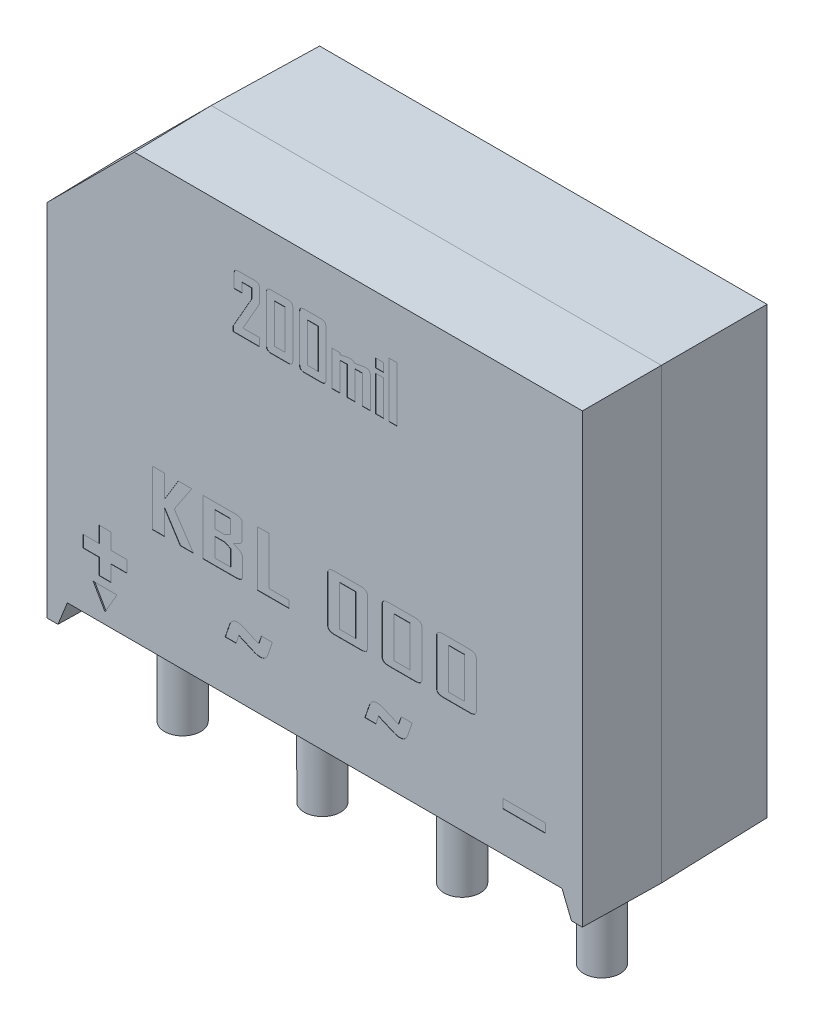
from build123d import *
from OCP.BRepFilletAPI import BRepFilletAPI_MakeChamfer

# Parameters (mm, degrees)
BODY_MAIN_DEPTH            = 2.82
BODY_MAIN_DEPTH_BACK       = 3.91
SKETCH1_W                  = 19.56
SKETCH1_H                  = 16.3
CUT_EXTRUDE2_DEPTH         = 25.773834988
BODY_CHAMFER_SIZE          = 3.2
BODY_CHAMFER1_SIZE         = 2.82
BODY_CHAMFER1_SIZE2        = 0.049223283
BODY_CHAMFER2_SIZE         = 0.068249304
BODY_CHAMFER2_SIZE_2       = 3.91
SKETCH10_R                 = 0.66
PIN_STRAIGHT_PATTERN_COUNT = 4
PIN_STRAIGHT_PATTERN_PITCH = 5.08
SKETCH5_W                  = 0.578313253
SKETCH5_H                  = 1.469879518
SKETCH5_W_2                = 0.385542169
SKETCH5_H_2                = 1.421686747
SKETCH5_W_3                = 0.294427711
SKETCH5_H_3                = 0.313253012
SKETCH5_W_4                = 0.289156626
SKETCH5_H_4                = 1.277108434
SKETCH5_H_5                = 2
SKETCH5_W_5                = 1.554216868
SKETCH5_H_6                = 0.325301205
TEXT_2_DEPTH               = 0.01
PIN1_MARK_DEPTH            = 0.04


with BuildPart() as part:
    # Sketch1 → BODY_MAIN (new, two sides: drawn at the far end of the back side and taken through both)
    with BuildSketch(Plane.XY.offset(-BODY_MAIN_DEPTH_BACK)):
        with Locations((7.62, 8.15)):
            Rectangle(SKETCH1_W, SKETCH1_H)
    extrude(amount=BODY_MAIN_DEPTH + BODY_MAIN_DEPTH_BACK)

    # Sketch18 → Cut-Extrude2 (cut, through all)
    with BuildSketch(Plane.XY.offset(2.82)):
        Polygon((16.576779019, 0.8), (-1.336779019, 0.8), (-1.66, 0), (-1.66, -1), (16.9, -1), (16.9, 0), align=None)
    extrude(amount=-CUT_EXTRUDE2_DEPTH, mode=Mode.SUBTRACT)

    # BODY_Chamfer
    body_chamfer_edges = [part.edges().sort_by_distance(p)[0] for p in [
        (-2.16, 16.3, -0.545),
    ]]
    chamfer(body_chamfer_edges, length=BODY_CHAMFER_SIZE)

    # BODY_Chamfer1: one chamfer whose edges measure the first distance from different faces: ONE call of the kernel's chamfer builder (chamfer() names one face for all edges)
    body_chamfer1_edges_1 = [part.edges().sort_by_distance(p)[0] for p in [
        (17.4, 8.15, 2.82),
    ]]
    body_chamfer1_side_1 = [part.faces().sort_by_distance(p)[0] for p in [
        (17.4, 8.15, -0.545),
    ]]
    body_chamfer1_edges_2 = [part.edges().sort_by_distance(p)[0] for p in [
        (9.22, 16.3, 2.82),
    ]]
    body_chamfer1_side_2 = [part.faces().sort_by_distance(p)[0] for p in [
        (9.22, 16.3, -0.545),
    ]]
    body_chamfer1_edges_3 = [part.edges().sort_by_distance(p)[0] for p in [
        (16.73838951, 0.4, 2.82),
    ]]
    body_chamfer1_side_3 = [part.faces().sort_by_distance(p)[0] for p in [
        (16.73838951, 0.4, -0.545),
    ]]
    body_chamfer1_edges_4 = [part.edges().sort_by_distance(p)[0] for p in [
        (7.62, 0.8, 2.82),
    ]]
    body_chamfer1_side_4 = [part.faces().sort_by_distance(p)[0] for p in [
        (7.62, 0.8, -0.545),
    ]]
    body_chamfer1_edges_5 = [part.edges().sort_by_distance(p)[0] for p in [
        (-1.49838951, 0.4, 2.82),
    ]]
    body_chamfer1_side_5 = [part.faces().sort_by_distance(p)[0] for p in [
        (-1.49838951, 0.4, -0.545),
    ]]
    body_chamfer1_edges_6 = [part.edges().sort_by_distance(p)[0] for p in [
        (-2.16, 6.55, 2.82),
    ]]
    body_chamfer1_side_6 = [part.faces().sort_by_distance(p)[0] for p in [
        (-2.16, 6.55, -0.545),
    ]]
    body_chamfer1_edges_7 = [part.edges().sort_by_distance(p)[0] for p in [
        (-0.56, 14.7, 2.82),
    ]]
    body_chamfer1_side_7 = [part.faces().sort_by_distance(p)[0] for p in [
        (-0.56, 14.7, -0.545),
    ]]
    body_chamfer1 = BRepFilletAPI_MakeChamfer(part.part.solid().wrapped)
    for e in body_chamfer1_edges_1:
        body_chamfer1.Add(BODY_CHAMFER1_SIZE, BODY_CHAMFER1_SIZE2, e.wrapped, body_chamfer1_side_1[0].wrapped)  # the first distance lies on this face
    for e in body_chamfer1_edges_2:
        body_chamfer1.Add(BODY_CHAMFER1_SIZE, BODY_CHAMFER1_SIZE2, e.wrapped, body_chamfer1_side_2[0].wrapped)  # the first distance lies on this face
    for e in body_chamfer1_edges_3:
        body_chamfer1.Add(BODY_CHAMFER1_SIZE, BODY_CHAMFER1_SIZE2, e.wrapped, body_chamfer1_side_3[0].wrapped)  # the first distance lies on this face
    for e in body_chamfer1_edges_4:
        body_chamfer1.Add(BODY_CHAMFER1_SIZE, BODY_CHAMFER1_SIZE2, e.wrapped, body_chamfer1_side_4[0].wrapped)  # the first distance lies on this face
    for e in body_chamfer1_edges_5:
        body_chamfer1.Add(BODY_CHAMFER1_SIZE, BODY_CHAMFER1_SIZE2, e.wrapped, body_chamfer1_side_5[0].wrapped)  # the first distance lies on this face
    for e in body_chamfer1_edges_6:
        body_chamfer1.Add(BODY_CHAMFER1_SIZE, BODY_CHAMFER1_SIZE2, e.wrapped, body_chamfer1_side_6[0].wrapped)  # the first distance lies on this face
    for e in body_chamfer1_edges_7:
        body_chamfer1.Add(BODY_CHAMFER1_SIZE, BODY_CHAMFER1_SIZE2, e.wrapped, body_chamfer1_side_7[0].wrapped)  # the first distance lies on this face
    add(Compound.cast(body_chamfer1.Shape()), mode=Mode.REPLACE)

    # BODY_Chamfer2
    # the kernel refuses this chamfer: 3.91, 0.068249304 mm, written as the material it takes off along each edge
    with BuildSketch(Plane(origin=(27.565942739, 0, -3.91), x_dir=(0, 1, 0), z_dir=(-1, 0, 0)), Plane(origin=(8.505942739, 0, -3.91), x_dir=(0, 1, 0), z_dir=(-1, 0, 0))) as body_chamfer2_piece_1:
        Polygon((BODY_CHAMFER2_SIZE * 0.999999998085, 0), (0, -BODY_CHAMFER2_SIZE_2), (0, 0), align=None)
    extrude(amount=20.831885478, mode=Mode.SUBTRACT)
    with BuildSketch(Plane(origin=(17.4, 26.465942739, -3.91), x_dir=(-1, 0, 0), z_dir=(0, -1, 0))) as body_chamfer2_piece_2:
        Polygon((BODY_CHAMFER2_SIZE * 0.999999998085, 0), (0, -BODY_CHAMFER2_SIZE_2), (0, 0), align=None)
    extrude(amount=36.631885478, mode=Mode.SUBTRACT)
    with BuildSketch(Plane(origin=(-9.125942739, 16.3, -3.91), x_dir=(0, 0, 1), z_dir=(1, 0, 0))) as body_chamfer2_piece_3:
        Polygon((BODY_CHAMFER2_SIZE_2, 0), (0, BODY_CHAMFER2_SIZE * 0.999999998085), (0, 0), align=None)
    extrude(amount=36.691885478, mode=Mode.SUBTRACT)
    with BuildSketch(Plane(origin=(-2.16, -10.165942739, -3.91), x_dir=(1, 0, 0), z_dir=(0, 1, 0))) as body_chamfer2_piece_4:
        Polygon((BODY_CHAMFER2_SIZE * 0.999999998085, 0), (0, -BODY_CHAMFER2_SIZE_2), (0, 0), align=None)
    extrude(amount=33.431885478, mode=Mode.SUBTRACT)
    with BuildSketch(Plane(origin=(-5.468229178, -9.425697974, -3.91), x_dir=(-0.9271838545667888, 0.37460659341590863, 0), z_dir=(0.3746065934159087, 0.9271838545667888, 0))) as body_chamfer2_piece_5_section:
        Polygon((BODY_CHAMFER2_SIZE * 0.999999998085, 0), (0, BODY_CHAMFER2_SIZE_2), (0, 0), align=None)
    body_chamfer2_piece_5 = extrude(amount=21.194713272, mode=Mode.PRIVATE)
    body_chamfer2_piece_5 = split(body_chamfer2_piece_5, bisect_by=Plane(origin=(-5.468229178, 0.865113907, -3.73037321), z_dir=(0, -0.9998476951563913, -0.01745240643728347)), keep=Keep.TOP, mode=Mode.PRIVATE)
    add(body_chamfer2_piece_5, mode=Mode.SUBTRACT)
    with BuildSketch(Plane(origin=(-11.502721758, 0.8, -3.91), x_dir=(0, 1, 0), z_dir=(1, 0, 0))) as body_chamfer2_piece_6_section:
        Polygon((BODY_CHAMFER2_SIZE * 0.999999998085, 0), (0, BODY_CHAMFER2_SIZE_2), (0, 0), align=None)
    body_chamfer2_piece_6 = extrude(amount=38.245443517, mode=Mode.PRIVATE)
    body_chamfer2_piece_6 = split(body_chamfer2_piece_6, bisect_by=Plane(origin=(12.692287806, 10.575418398, -3.454507316), z_dir=(-0.9270426399748221, -0.3745495390172843, -0.01745240643728383)), keep=Keep.TOP, mode=Mode.PRIVATE)
    body_chamfer2_piece_6 = split(body_chamfer2_piece_6, bisect_by=Plane(origin=(-2.829289047, -2.704294284, -4.073285125), z_dir=(0.9270426399748225, -0.37454953901728366, -0.01745240643728332)), keep=Keep.TOP, mode=Mode.PRIVATE)
    add(body_chamfer2_piece_6, mode=Mode.SUBTRACT)
    with BuildSketch(Plane(origin=(12.768549841, 10.225697974, -3.91), x_dir=(0.9271838545667884, 0.37460659341590935, 0), z_dir=(0.3746065934159094, -0.9271838545667885, 0))) as body_chamfer2_piece_7_section:
        Polygon((BODY_CHAMFER2_SIZE * 0.999999998085, 0), (0, BODY_CHAMFER2_SIZE_2), (0, 0), align=None)
    body_chamfer2_piece_7 = extrude(amount=21.194713272, mode=Mode.PRIVATE)
    body_chamfer2_piece_7 = split(body_chamfer2_piece_7, bisect_by=Plane(origin=(12.768549841, 0.871099456, -4.073285125), z_dir=(0, -0.9998476951563913, -0.01745240643728347)), keep=Keep.TOP, mode=Mode.PRIVATE)
    add(body_chamfer2_piece_7, mode=Mode.SUBTRACT)
    with BuildSketch(Plane(origin=(8.228407048, 23.488407048, -3.91), x_dir=(0, 0, 1), z_dir=(-0.7071067811865477, -0.7071067811865475, 0))) as body_chamfer2_piece_8:
        Polygon((BODY_CHAMFER2_SIZE_2, 0), (0, -BODY_CHAMFER2_SIZE * 0.999999998085), (0, 0), align=None)
    extrude(amount=24.857368878, mode=Mode.SUBTRACT)

    # PIN_straight: sweep along a path in Sketch12
    with BuildLine(Plane(origin=(0, 0, 0), x_dir=(0, 0, -1), z_dir=(1, 0, 0))) as pin_straight_path:
        Line((0, -3.6), (0, 0))
        Line((0, 0), (0, 1.3))
    # Sketch10 → PIN_straight (sweep)
    with BuildSketch(Plane(origin=(0, 0, 0), x_dir=(1, 0, 0), z_dir=(0, 1, 0))):
        Circle(SKETCH10_R)
    pin_straight = sweep(path=pin_straight_path.line)

    # PIN_straight_Pattern: PIN_straight ×4
    with Locations(*[(i * PIN_STRAIGHT_PATTERN_PITCH, 0, 0) for i in range(1, PIN_STRAIGHT_PATTERN_COUNT)]):
        add(pin_straight)

    # Sketch5 → text 2 (cut)
    # profile 1 of 17: a face of its own
    with BuildSketch(Plane.XY.offset(2.82)):
        Polygon((3.215180723, 4.699611642), (2.733253012, 4.699611642), (2.154939759, 5.604355617), (2.154939759, 4.699611642), (1.721204819, 4.699611642), (1.721204819, 6.699611642), (2.154939759, 6.699611642), (2.154939759, 5.864897786), (2.660963855, 6.699611642), (3.142891566, 6.699611642), (3.142891566, 6.685680919), (2.516385542, 5.747804413), align=None)
    # profile 2 of 17: a face of its own
    with BuildSketch(Plane.XY.offset(2.82)):
        with BuildLine():
            add(Edge.make_bspline(
                [(5.000722892, 4.857367666), (4.99970317, 4.845316128), (4.997747343, 4.822201283), (4.984927836, 4.790265324), (4.965851509, 4.762598067), (4.938650178, 4.740604955), (4.905285777, 4.722631937), (4.864712097, 4.710356641), (4.817560014, 4.702064158), (4.783770402, 4.700463645), (4.765783133, 4.699611642)],
                knots=[0, 0, 0, 0, 0.912786698, 1.750724646, 2.577393401, 3.435475294, 4.376805661, 5.436517424, 6.635377905, 8, 8, 8, 8], degree=3))
            Line((4.765783133, 4.699611642), (3.554939759, 4.699611642))
            Line((3.554939759, 4.699611642), (3.554939759, 6.699611642))
            Line((3.554939759, 6.699611642), (4.758253012, 6.699611642))
            add(Edge.make_bspline(
                [(4.758253012, 6.699611642), (4.775615053, 6.698759619), (4.808286003, 6.697156329), (4.853924127, 6.688820642), (4.893303991, 6.67662379), (4.925576224, 6.658498119), (4.952005817, 6.636597521), (4.970231662, 6.608806016), (4.982615225, 6.576958622), (4.984616956, 6.553900873), (4.985662651, 6.541855617)],
                knots=[0, 0, 0, 0, 1.345028062, 2.531001147, 3.585414672, 4.521117009, 5.382572416, 6.215698828, 7.067889818, 8, 8, 8, 8], degree=3))
            Line((4.985662651, 6.541855617), (4.985662651, 6.018512244))
            add(Edge.make_bspline(
                [(4.985662651, 6.018512244), (4.985343869, 6.009340281), (4.98472473, 5.991526472), (4.980760616, 5.965472491), (4.972843075, 5.941422688), (4.96332544, 5.918322395), (4.949791596, 5.897321399), (4.934020337, 5.877495462), (4.914903414, 5.859613056), (4.900451678, 5.849417362), (4.893042169, 5.844189955)],
                knots=[0, 0, 0, 0, 1.067017439, 2.07236394, 3.050976564, 4.005345974, 4.969154372, 5.944714955, 6.946240447, 8, 8, 8, 8], degree=3))
            add(Edge.make_bspline(
                [(4.893042169, 5.844189955), (4.890919904, 5.842914723), (4.88480326, 5.839239338), (4.872163917, 5.832973076), (4.853263213, 5.823977147), (4.828128446, 5.811995312), (4.796799981, 5.796839081), (4.759302367, 5.77883387), (4.715536077, 5.758052357), (4.684218825, 5.74351177), (4.66751506, 5.73575622)],
                knots=[0, 0, 0, 0, 0.237364915, 0.684116738, 1.351591564, 2.245176257, 3.354019085, 4.688968736, 6.233986598, 8, 8, 8, 8], degree=3))
            add(Edge.make_bspline(
                [(4.66751506, 5.73575622), (4.684811439, 5.727550336), (4.717123035, 5.712220814), (4.762752969, 5.691440309), (4.801232451, 5.672101031), (4.834063539, 5.65734676), (4.859614494, 5.64391981), (4.87946714, 5.634933919), (4.892394205, 5.627882942), (4.898820358, 5.624067984), (4.900948795, 5.622804413)],
                knots=[0, 0, 0, 0, 1.771403171, 3.309181819, 4.638758348, 5.755620115, 6.63848141, 7.308497844, 7.770964207, 8, 8, 8, 8], degree=3))
            add(Edge.make_bspline(
                [(4.900948795, 5.622804413), (4.908882868, 5.617223639), (4.924450456, 5.606273501), (4.944655839, 5.58699005), (4.961996641, 5.566289844), (4.976255893, 5.544210183), (4.987551507, 5.520472911), (4.994730241, 5.494978362), (5.000046765, 5.468153317), (5.00049455, 5.449639707), (5.000722892, 5.440198991)],
                knots=[0, 0, 0, 0, 1.069259946, 2.098014239, 3.071585164, 4.043578497, 4.991592967, 5.960027321, 6.959748817, 8, 8, 8, 8], degree=3))
            Line((5.000722892, 5.440198991), (5.000722892, 4.857367666))
        make_face()
        Polygon((4.551927711, 5.961283328), (4.551927711, 6.458647786), (3.988674699, 6.458647786), (3.988674699, 5.856238148), (4.338072289, 5.856238148), align=None, mode=Mode.SUBTRACT)
        Polygon((4.566987952, 4.940575497), (4.566987952, 5.51700622), (4.34560241, 5.615274292), (3.988674699, 5.615274292), (3.988674699, 4.940575497), align=None, mode=Mode.SUBTRACT)
    # profile 3 of 17: a face of its own
    with BuildSketch(Plane.XY.offset(2.82)):
        Polygon((6.689879518, 4.699611642), (5.533253012, 4.699611642), (5.533253012, 6.699611642), (5.966987952, 6.699611642), (5.966987952, 4.964671883), (6.689879518, 4.964671883), align=None)
    # profile 4 of 17: a face of its own
    with BuildSketch(Plane.XY.offset(2.82)):
        with BuildLine():
            add(Edge.make_bspline(
                [(9.538072289, 4.857367666), (9.537052567, 4.845316128), (9.535096741, 4.822201283), (9.522277234, 4.790265324), (9.503200907, 4.762598067), (9.475999575, 4.740604955), (9.442635174, 4.722631937), (9.402061494, 4.710356641), (9.354909412, 4.702064158), (9.321119799, 4.700463645), (9.30313253, 4.699611642)],
                knots=[0, 0, 0, 0, 0.912786698, 1.750724646, 2.577393401, 3.435475294, 4.376805661, 5.436517424, 6.635377905, 8, 8, 8, 8], degree=3))
            Line((9.30313253, 4.699611642), (8.327228916, 4.699611642))
            add(Edge.make_bspline(
                [(8.327228916, 4.699611642), (8.309241646, 4.700463645), (8.275452034, 4.702064158), (8.228299952, 4.710356641), (8.187726271, 4.722631937), (8.154361871, 4.740604955), (8.127160539, 4.762598067), (8.108084212, 4.790265324), (8.095264705, 4.822201283), (8.093308879, 4.845316128), (8.092289157, 4.857367666)],
                knots=[0, 0, 0, 0, 1.364622095, 2.563482576, 3.623194339, 4.564524706, 5.422606599, 6.249275354, 7.087213302, 8, 8, 8, 8], degree=3))
            Line((8.092289157, 4.857367666), (8.092289157, 6.541855617))
            add(Edge.make_bspline(
                [(8.092289157, 6.541855617), (8.093274744, 6.553919823), (8.095168889, 6.577105325), (8.108514194, 6.608977836), (8.127951634, 6.63677701), (8.155938448, 6.658604559), (8.190010146, 6.676584747), (8.231560437, 6.688957277), (8.279860835, 6.697107164), (8.314516026, 6.698744287), (8.332876506, 6.699611642)],
                knots=[0, 0, 0, 0, 0.898785286, 1.727323638, 2.546744885, 3.406099796, 4.349527069, 5.410850413, 6.628256588, 8, 8, 8, 8], degree=3))
            Line((8.332876506, 6.699611642), (9.30313253, 6.699611642))
            add(Edge.make_bspline(
                [(9.30313253, 6.699611642), (9.321119799, 6.698759638), (9.354909412, 6.697159125), (9.402061494, 6.688866642), (9.442635174, 6.676591346), (9.475999575, 6.658618328), (9.503200907, 6.636625216), (9.522277234, 6.608957959), (9.535096741, 6.577022), (9.537052567, 6.553907155), (9.538072289, 6.541855617)],
                knots=[0, 0, 0, 0, 1.364622095, 2.563482576, 3.623194339, 4.564524706, 5.422606599, 6.249275354, 7.087213302, 8, 8, 8, 8], degree=3))
            Line((9.538072289, 6.541855617), (9.538072289, 4.857367666))
        make_face()
        with Locations((8.815180722, 5.699611642)):
            Rectangle(SKETCH5_W, SKETCH5_H, mode=Mode.SUBTRACT)
    # profile 5 of 17: a face of its own
    with BuildSketch(Plane.XY.offset(2.82)):
        with BuildLine():
            add(Edge.make_bspline(
                [(11.516385542, 4.857367666), (11.51536582, 4.845316128), (11.513409994, 4.822201283), (11.500590487, 4.790265324), (11.48151416, 4.762598067), (11.454312828, 4.740604955), (11.420948427, 4.722631937), (11.380374747, 4.710356641), (11.333222665, 4.702064158), (11.299433052, 4.700463645), (11.281445783, 4.699611642)],
                knots=[0, 0, 0, 0, 0.912786698, 1.750724646, 2.577393401, 3.435475294, 4.376805661, 5.436517424, 6.635377905, 8, 8, 8, 8], degree=3))
            Line((11.281445783, 4.699611642), (10.305542169, 4.699611642))
            add(Edge.make_bspline(
                [(10.305542169, 4.699611642), (10.287554899, 4.700463645), (10.253765287, 4.702064158), (10.206613205, 4.710356641), (10.166039524, 4.722631937), (10.132675124, 4.740604955), (10.105473792, 4.762598067), (10.086397465, 4.790265324), (10.073577958, 4.822201283), (10.071622132, 4.845316128), (10.07060241, 4.857367666)],
                knots=[0, 0, 0, 0, 1.364622095, 2.563482576, 3.623194339, 4.564524706, 5.422606599, 6.249275354, 7.087213302, 8, 8, 8, 8], degree=3))
            Line((10.07060241, 4.857367666), (10.07060241, 6.541855617))
            add(Edge.make_bspline(
                [(10.07060241, 6.541855617), (10.071587997, 6.553919823), (10.073482142, 6.577105325), (10.086827447, 6.608977836), (10.106264887, 6.63677701), (10.134251701, 6.658604559), (10.168323399, 6.676584747), (10.20987369, 6.688957277), (10.258174088, 6.697107164), (10.292829279, 6.698744287), (10.311189759, 6.699611642)],
                knots=[0, 0, 0, 0, 0.898785286, 1.727323638, 2.546744885, 3.406099796, 4.349527069, 5.410850413, 6.628256588, 8, 8, 8, 8], degree=3))
            Line((10.311189759, 6.699611642), (11.281445783, 6.699611642))
            add(Edge.make_bspline(
                [(11.281445783, 6.699611642), (11.299433052, 6.698759638), (11.333222665, 6.697159125), (11.380374747, 6.688866642), (11.420948427, 6.676591346), (11.454312828, 6.658618328), (11.48151416, 6.636625216), (11.500590487, 6.608957959), (11.513409994, 6.577022), (11.51536582, 6.553907155), (11.516385542, 6.541855617)],
                knots=[0, 0, 0, 0, 1.364622095, 2.563482576, 3.623194339, 4.564524706, 5.422606599, 6.249275354, 7.087213302, 8, 8, 8, 8], degree=3))
            Line((11.516385542, 6.541855617), (11.516385542, 4.857367666))
        make_face()
        with Locations((10.793493976, 5.699611642)):
            Rectangle(SKETCH5_W, SKETCH5_H, mode=Mode.SUBTRACT)
    # profile 6 of 17: a face of its own
    with BuildSketch(Plane.XY.offset(2.82)):
        with BuildLine():
            add(Edge.make_bspline(
                [(13.494698795, 4.857367666), (13.493679073, 4.845316128), (13.491723247, 4.822201283), (13.47890374, 4.790265324), (13.459827413, 4.762598067), (13.432626081, 4.740604955), (13.39926168, 4.722631937), (13.358688, 4.710356641), (13.311535918, 4.702064158), (13.277746305, 4.700463645), (13.259759036, 4.699611642)],
                knots=[0, 0, 0, 0, 0.912786698, 1.750724646, 2.577393401, 3.435475294, 4.376805661, 5.436517424, 6.635377905, 8, 8, 8, 8], degree=3))
            Line((13.259759036, 4.699611642), (12.283855422, 4.699611642))
            add(Edge.make_bspline(
                [(12.283855422, 4.699611642), (12.265868152, 4.700463645), (12.23207854, 4.702064158), (12.184926458, 4.710356641), (12.144352777, 4.722631937), (12.110988377, 4.740604955), (12.083787045, 4.762598067), (12.064710718, 4.790265324), (12.051891211, 4.822201283), (12.049935385, 4.845316128), (12.048915663, 4.857367666)],
                knots=[0, 0, 0, 0, 1.364622095, 2.563482576, 3.623194339, 4.564524706, 5.422606599, 6.249275354, 7.087213302, 8, 8, 8, 8], degree=3))
            Line((12.048915663, 4.857367666), (12.048915663, 6.541855617))
            add(Edge.make_bspline(
                [(12.048915663, 6.541855617), (12.04990125, 6.553919823), (12.051795395, 6.577105325), (12.0651407, 6.608977836), (12.08457814, 6.63677701), (12.112564954, 6.658604559), (12.146636652, 6.676584747), (12.188186943, 6.688957277), (12.236487341, 6.697107164), (12.271142532, 6.698744287), (12.289503012, 6.699611642)],
                knots=[0, 0, 0, 0, 0.898785286, 1.727323638, 2.546744885, 3.406099796, 4.349527069, 5.410850413, 6.628256588, 8, 8, 8, 8], degree=3))
            Line((12.289503012, 6.699611642), (13.259759036, 6.699611642))
            add(Edge.make_bspline(
                [(13.259759036, 6.699611642), (13.277746305, 6.698759638), (13.311535918, 6.697159125), (13.358688, 6.688866642), (13.39926168, 6.676591346), (13.432626081, 6.658618328), (13.459827413, 6.636625216), (13.47890374, 6.608957959), (13.491723247, 6.577022), (13.493679073, 6.553907155), (13.494698795, 6.541855617)],
                knots=[0, 0, 0, 0, 1.364622095, 2.563482576, 3.623194339, 4.564524706, 5.422606599, 6.249275354, 7.087213302, 8, 8, 8, 8], degree=3))
            Line((13.494698795, 6.541855617), (13.494698795, 4.857367666))
        make_face()
        with Locations((12.771807229, 5.699611642)):
            Rectangle(SKETCH5_W, SKETCH5_H, mode=Mode.SUBTRACT)
    # profile 7 of 17: a face of its own
    with BuildSketch(Plane.XY.offset(2.82)):
        with BuildLine():
            add(Edge.make_bspline(
                [(5.62, 13.852195587), (5.61912135, 13.836061591), (5.617293817, 13.802503978), (5.604221632, 13.751330297), (5.584394731, 13.697484647), (5.565494647, 13.662349415), (5.55561747, 13.643987756)],
                knots=[0, 0, 0, 0, 0.878890772, 1.828032848, 2.864930751, 4, 4, 4, 4], degree=3))
            Line((5.55561747, 13.643987756), (5.011942771, 12.689544985))
            Line((5.011942771, 12.689544985), (5.62, 12.689544985))
            Line((5.62, 12.689544985), (5.62, 12.400388358))
            Line((5.62, 12.400388358), (4.656144578, 12.400388358))
            Line((4.656144578, 12.400388358), (4.656144578, 12.58111125))
            Line((4.656144578, 12.58111125), (5.330843373, 13.765599202))
            Line((5.330843373, 13.765599202), (5.330843373, 14.111231732))
            Line((5.330843373, 14.111231732), (4.96939759, 14.111231732))
            Line((4.96939759, 14.111231732), (4.96939759, 13.773882334))
            Line((4.96939759, 13.773882334), (4.680240964, 13.773882334))
            Line((4.680240964, 13.773882334), (4.680240964, 14.242632334))
            add(Edge.make_bspline(
                [(4.680240964, 14.242632334), (4.681091559, 14.254617149), (4.682698142, 14.277253747), (4.691222482, 14.308811933), (4.703730333, 14.336257155), (4.722170371, 14.358458951), (4.744372167, 14.37689899), (4.771817389, 14.38940684), (4.803375576, 14.397931181), (4.826012173, 14.399537763), (4.837996988, 14.400388358)],
                knots=[0, 0, 0, 0, 1.144701434, 2.162081395, 3.105417678, 4, 4.894582322, 5.837918605, 6.855298566, 8, 8, 8, 8], degree=3))
            Line((4.837996988, 14.400388358), (5.462243976, 14.400388358))
            add(Edge.make_bspline(
                [(5.462243976, 14.400388358), (5.474228791, 14.399537763), (5.496865388, 14.397931181), (5.528423574, 14.38940684), (5.555868796, 14.37689899), (5.578070592, 14.358458951), (5.596510631, 14.336257155), (5.609018482, 14.308811933), (5.617542822, 14.277253747), (5.619149404, 14.254617149), (5.62, 14.242632334)],
                knots=[0, 0, 0, 0, 1.144701434, 2.162081395, 3.105417678, 4, 4.894582322, 5.837918605, 6.855298566, 8, 8, 8, 8], degree=3))
            Line((5.62, 14.242632334), (5.62, 13.852195587))
        make_face()
    # profile 8 of 17: a face of its own
    with BuildSketch(Plane.XY.offset(2.82)):
        with BuildLine():
            add(Edge.make_bspline(
                [(6.824819277, 12.558144383), (6.823968682, 12.546159568), (6.822362099, 12.52352297), (6.813837759, 12.491964784), (6.801329908, 12.464519562), (6.78288987, 12.442317766), (6.760688074, 12.423877727), (6.733242852, 12.411369877), (6.701684665, 12.402845536), (6.679048068, 12.401238954), (6.667063253, 12.400388358)],
                knots=[0, 0, 0, 0, 1.144701434, 2.162081395, 3.105417678, 4, 4.894582322, 5.837918605, 6.855298566, 8, 8, 8, 8], degree=3))
            Line((6.667063253, 12.400388358), (6.01871988, 12.400388358))
            add(Edge.make_bspline(
                [(6.01871988, 12.400388358), (6.006735065, 12.401238954), (5.984098467, 12.402845536), (5.952540281, 12.411369877), (5.925095059, 12.423877727), (5.902893263, 12.442317766), (5.884453224, 12.464519562), (5.871945374, 12.491964784), (5.863421033, 12.52352297), (5.861814451, 12.546159568), (5.860963855, 12.558144383)],
                knots=[0, 0, 0, 0, 1.144701434, 2.162081395, 3.105417678, 4, 4.894582322, 5.837918605, 6.855298566, 8, 8, 8, 8], degree=3))
            Line((5.860963855, 12.558144383), (5.860963855, 14.242632334))
            add(Edge.make_bspline(
                [(5.860963855, 14.242632334), (5.861777615, 14.254625835), (5.863316877, 14.27731206), (5.872341843, 14.30884384), (5.885213508, 14.336297609), (5.904048531, 14.358469386), (5.926697595, 14.377009378), (5.954942544, 14.389458747), (5.987383983, 14.397879711), (6.010629491, 14.399523425), (6.022861446, 14.400388358)],
                knots=[0, 0, 0, 0, 1.129786222, 2.13703947, 3.073253258, 3.963672955, 4.855819033, 5.808252896, 6.846686804, 8, 8, 8, 8], degree=3))
            Line((6.022861446, 14.400388358), (6.667063253, 14.400388358))
            add(Edge.make_bspline(
                [(6.667063253, 14.400388358), (6.679048068, 14.399537763), (6.701684665, 14.397931181), (6.733242852, 14.38940684), (6.760688074, 14.37689899), (6.78288987, 14.358458951), (6.801329908, 14.336257155), (6.813837759, 14.308811933), (6.822362099, 14.277253747), (6.823968682, 14.254617149), (6.824819277, 14.242632334)],
                knots=[0, 0, 0, 0, 1.144701434, 2.162081395, 3.105417678, 4, 4.894582322, 5.837918605, 6.855298566, 8, 8, 8, 8], degree=3))
            Line((6.824819277, 14.242632334), (6.824819277, 12.558144383))
        make_face()
        with Locations((6.342891567, 13.400388359)):
            Rectangle(SKETCH5_W_2, SKETCH5_H_2, mode=Mode.SUBTRACT)
    # profile 9 of 17: a face of its own
    with BuildSketch(Plane.XY.offset(2.82)):
        with BuildLine():
            add(Edge.make_bspline(
                [(8.029638554, 12.558144383), (8.028787959, 12.546159568), (8.027181376, 12.52352297), (8.018657036, 12.491964784), (8.006149185, 12.464519562), (7.987709147, 12.442317766), (7.965507351, 12.423877727), (7.938062129, 12.411369877), (7.906503942, 12.402845536), (7.883867345, 12.401238954), (7.87188253, 12.400388358)],
                knots=[0, 0, 0, 0, 1.144701434, 2.162081395, 3.105417678, 4, 4.894582322, 5.837918605, 6.855298566, 8, 8, 8, 8], degree=3))
            Line((7.87188253, 12.400388358), (7.223539157, 12.400388358))
            add(Edge.make_bspline(
                [(7.223539157, 12.400388358), (7.211554342, 12.401238954), (7.188917744, 12.402845536), (7.157359558, 12.411369877), (7.129914336, 12.423877727), (7.10771254, 12.442317766), (7.089272501, 12.464519562), (7.076764651, 12.491964784), (7.06824031, 12.52352297), (7.066633728, 12.546159568), (7.065783133, 12.558144383)],
                knots=[0, 0, 0, 0, 1.144701434, 2.162081395, 3.105417678, 4, 4.894582322, 5.837918605, 6.855298566, 8, 8, 8, 8], degree=3))
            Line((7.065783133, 12.558144383), (7.065783133, 14.242632334))
            add(Edge.make_bspline(
                [(7.065783133, 14.242632334), (7.066596892, 14.254625835), (7.068136154, 14.27731206), (7.077161121, 14.30884384), (7.090032785, 14.336297609), (7.108867808, 14.358469386), (7.131516872, 14.377009378), (7.159761821, 14.389458747), (7.19220326, 14.397879711), (7.215448768, 14.399523425), (7.227680723, 14.400388358)],
                knots=[0, 0, 0, 0, 1.129786222, 2.13703947, 3.073253258, 3.963672955, 4.855819033, 5.808252896, 6.846686804, 8, 8, 8, 8], degree=3))
            Line((7.227680723, 14.400388358), (7.87188253, 14.400388358))
            add(Edge.make_bspline(
                [(7.87188253, 14.400388358), (7.883867345, 14.399537763), (7.906503942, 14.397931181), (7.938062129, 14.38940684), (7.965507351, 14.37689899), (7.987709147, 14.358458951), (8.006149185, 14.336257155), (8.018657036, 14.308811933), (8.027181376, 14.277253747), (8.028787959, 14.254617149), (8.029638554, 14.242632334)],
                knots=[0, 0, 0, 0, 1.144701434, 2.162081395, 3.105417678, 4, 4.894582322, 5.837918605, 6.855298566, 8, 8, 8, 8], degree=3))
            Line((8.029638554, 14.242632334), (8.029638554, 12.558144383))
        make_face()
        with Locations((7.547710844, 13.400388359)):
            Rectangle(SKETCH5_W_2, SKETCH5_H_2, mode=Mode.SUBTRACT)
    # profile 10 of 17: a face of its own
    with BuildSketch(Plane.XY.offset(2.82)):
        with BuildLine():
            Line((9.644096386, 12.400388358), (9.354939759, 12.400388358))
            Line((9.354939759, 12.400388358), (9.354939759, 13.436532937))
            Line((9.354939759, 13.436532937), (9.089879518, 13.433520889))
            Line((9.089879518, 13.433520889), (9.089879518, 12.400388358))
            Line((9.089879518, 12.400388358), (8.800722892, 12.400388358))
            Line((8.800722892, 12.400388358), (8.800722892, 13.436532937))
            Line((8.800722892, 13.436532937), (8.535662651, 13.433520889))
            Line((8.535662651, 13.433520889), (8.535662651, 12.400388358))
            Line((8.535662651, 12.400388358), (8.246506024, 12.400388358))
            Line((8.246506024, 12.400388358), (8.246506024, 13.677496792))
            Line((8.246506024, 13.677496792), (8.535662651, 13.677496792))
            Line((8.535662651, 13.677496792), (8.535662651, 13.611231732))
            add(Edge.make_bspline(
                [(8.535662651, 13.611231732), (8.567667117, 13.618253235), (8.631556328, 13.632269974), (8.69542815, 13.646365734), (8.727304217, 13.653400407)],
                knots=[0, 0, 0, 0, 1.001873907, 2, 2, 2, 2], degree=3))
            add(Edge.make_bspline(
                [(8.727304217, 13.653400407), (8.745849633, 13.657081589), (8.781319843, 13.664122269), (8.832335347, 13.67154439), (8.878437502, 13.676485758), (8.907514506, 13.677173149), (8.921204819, 13.677496792)],
                knots=[0, 0, 0, 0, 1.159213511, 2.217127275, 3.160570827, 4, 4, 4, 4], degree=3))
            add(Edge.make_bspline(
                [(8.921204819, 13.677496792), (8.930001265, 13.677301948), (8.946787554, 13.676930125), (8.970795782, 13.673534881), (8.992242752, 13.667897705), (9.011586327, 13.660487947), (9.028317651, 13.650142604), (9.042659888, 13.637683161), (9.054922582, 13.62311483), (9.060370358, 13.611752879), (9.06314759, 13.605960648)],
                knots=[0, 0, 0, 0, 1.249781828, 2.384963057, 3.436325833, 4.396912797, 5.317757292, 6.215507025, 7.090279742, 8, 8, 8, 8], degree=3))
            add(Edge.make_bspline(
                [(9.06314759, 13.605960648), (9.097296715, 13.612928737), (9.165645406, 13.62687521), (9.233842937, 13.641543018), (9.267966867, 13.648882334)],
                knots=[0, 0, 0, 0, 0.999261983, 2, 2, 2, 2], degree=3))
            add(Edge.make_bspline(
                [(9.267966867, 13.648882334), (9.289150392, 13.653167564), (9.328900591, 13.661208659), (9.384757236, 13.670311799), (9.432760397, 13.676027924), (9.462106811, 13.677038349), (9.475421687, 13.677496792)],
                knots=[0, 0, 0, 0, 1.236566788, 2.320377627, 3.23793203, 4, 4, 4, 4], degree=3))
            add(Edge.make_bspline(
                [(9.475421687, 13.677496792), (9.488390943, 13.676895464), (9.512962021, 13.67575621), (9.547332062, 13.667951623), (9.576638221, 13.655025026), (9.601042216, 13.637528373), (9.62021374, 13.614794725), (9.633708141, 13.587128044), (9.641991456, 13.554837644), (9.643370689, 13.531840789), (9.644096386, 13.519740768)],
                knots=[0, 0, 0, 0, 1.186326658, 2.247571019, 3.203642386, 4.099401687, 4.971289667, 5.895665404, 6.892783752, 8, 8, 8, 8], degree=3))
            Line((9.644096386, 13.519740768), (9.644096386, 12.400388358))
        make_face()
    # profile 11 of 17: a face of its own
    with BuildSketch(Plane.XY.offset(2.82)):
        with Locations((9.981445783, 14.002797997)):
            Rectangle(SKETCH5_W_3, SKETCH5_H_3)
    # profile 12 of 17: a face of its own
    with BuildSketch(Plane.XY.offset(2.82)):
        with Locations((9.981445783, 13.038942575)):
            Rectangle(SKETCH5_W_4, SKETCH5_H_4)
    # profile 13 of 17: a face of its own
    with BuildSketch(Plane.XY.offset(2.82)):
        with Locations((10.463373494, 13.400388358)):
            Rectangle(SKETCH5_W_4, SKETCH5_H_5)
    # profile 14 of 17: a face of its own
    with BuildSketch(Plane.XY.offset(2.82)):
        Polygon((0.795180723, 2.860013144), (0.21686747, 2.860013144), (0.21686747, 2.281699891), (-0.21686747, 2.281699891), (-0.21686747, 2.860013144), (-0.795180723, 2.860013144), (-0.795180723, 3.293748084), (-0.21686747, 3.293748084), (-0.21686747, 3.872061337), (0.21686747, 3.872061337), (0.21686747, 3.293748084), (0.795180723, 3.293748084), align=None)
    # profile 15 of 17: a face of its own
    with BuildSketch(Plane.XY.offset(2.82)):
        with Locations((15.24, 2.444350493)):
            Rectangle(SKETCH5_W_5, SKETCH5_H_6)
    # profile 16 of 17: a face of its own
    with BuildSketch(Plane.XY.offset(2.82)):
        with BuildLine():
            add(Edge.make_bspline(
                [(5.924691265, 2.870743565), (5.918007986, 2.852838839), (5.905127168, 2.818330702), (5.878806291, 2.771592211), (5.848547774, 2.731625718), (5.813281049, 2.699211202), (5.773703645, 2.673988756), (5.729613016, 2.655741393), (5.681055644, 2.644826117), (5.647263515, 2.64371634), (5.629887048, 2.643145674)],
                knots=[0, 0, 0, 0, 1.140595411, 2.198292223, 3.192843864, 4.124385214, 5.044994205, 5.983033816, 6.962842946, 8, 8, 8, 8], degree=3))
            add(Edge.make_bspline(
                [(5.629887048, 2.643145674), (5.612339788, 2.643865001), (5.575846337, 2.645361003), (5.519901438, 2.655963679), (5.461332767, 2.673948768), (5.422132415, 2.689717811), (5.401724398, 2.6979273)],
                knots=[0, 0, 0, 0, 0.891392593, 1.853850235, 2.88269722, 4, 4, 4, 4], degree=3))
            Line((5.401724398, 2.6979273), (4.86125, 2.9323023))
            Line((4.86125, 2.9323023), (4.762981928, 2.643145674))
            Line((4.762981928, 2.643145674), (4.365391566, 2.643145674))
            Line((4.365391566, 2.643145674), (4.522959337, 3.105683325))
            add(Edge.make_bspline(
                [(4.522959337, 3.105683325), (4.529707268, 3.123363017), (4.542679002, 3.157349183), (4.568002694, 3.203849542), (4.598969585, 3.242777396), (4.634143104, 3.274855717), (4.673989187, 3.299654429), (4.718324333, 3.317266356), (4.767157426, 3.328233888), (4.801326182, 3.329329424), (4.818893072, 3.329892662)],
                knots=[0, 0, 0, 0, 1.133457741, 2.178877341, 3.158549732, 4.101139904, 5.018407234, 5.95490082, 6.948570622, 8, 8, 8, 8], degree=3))
            add(Edge.make_bspline(
                [(4.818893072, 3.329892662), (4.835689351, 3.329167832), (4.870876936, 3.32764934), (4.925274504, 3.316896536), (4.982936453, 3.299096301), (5.021754804, 3.28332522), (5.041972892, 3.275111035)],
                knots=[0, 0, 0, 0, 0.871622166, 1.826016328, 2.867705877, 4, 4, 4, 4], degree=3))
            Line((5.041972892, 3.275111035), (5.585271084, 3.040736035))
            Line((5.585271084, 3.040736035), (5.683539157, 3.329892662))
            Line((5.683539157, 3.329892662), (6.081129518, 3.329892662))
            Line((6.081129518, 3.329892662), (5.924691265, 2.870743565))
        make_face()
    # profile 17 of 17: a face of its own
    with BuildSketch(Plane.XY.offset(2.82)):
        with BuildLine():
            add(Edge.make_bspline(
                [(11.004691265, 2.870743565), (10.998007986, 2.852838839), (10.985127168, 2.818330702), (10.958806291, 2.771592211), (10.928547774, 2.731625718), (10.893281049, 2.699211202), (10.853703645, 2.673988756), (10.809613016, 2.655741393), (10.761055644, 2.644826117), (10.727263515, 2.64371634), (10.709887048, 2.643145674)],
                knots=[0, 0, 0, 0, 1.140595411, 2.198292223, 3.192843864, 4.124385214, 5.044994205, 5.983033816, 6.962842946, 8, 8, 8, 8], degree=3))
            add(Edge.make_bspline(
                [(10.709887048, 2.643145674), (10.692339788, 2.643865001), (10.655846337, 2.645361003), (10.599901438, 2.655963679), (10.541332767, 2.673948768), (10.502132415, 2.689717811), (10.481724398, 2.6979273)],
                knots=[0, 0, 0, 0, 0.891392593, 1.853850235, 2.88269722, 4, 4, 4, 4], degree=3))
            Line((10.481724398, 2.6979273), (9.94125, 2.9323023))
            Line((9.94125, 2.9323023), (9.842981928, 2.643145674))
            Line((9.842981928, 2.643145674), (9.445391566, 2.643145674))
            Line((9.445391566, 2.643145674), (9.602959337, 3.105683325))
            add(Edge.make_bspline(
                [(9.602959337, 3.105683325), (9.609707268, 3.123363017), (9.622679002, 3.157349183), (9.648002694, 3.203849542), (9.678969585, 3.242777396), (9.714143104, 3.274855717), (9.753989187, 3.299654429), (9.798324333, 3.317266356), (9.847157426, 3.328233888), (9.881326182, 3.329329424), (9.898893072, 3.329892662)],
                knots=[0, 0, 0, 0, 1.133457741, 2.178877341, 3.158549732, 4.101139904, 5.018407234, 5.95490082, 6.948570622, 8, 8, 8, 8], degree=3))
            add(Edge.make_bspline(
                [(9.898893072, 3.329892662), (9.915689351, 3.329167832), (9.950876936, 3.32764934), (10.005274504, 3.316896536), (10.062936453, 3.299096301), (10.101754804, 3.28332522), (10.121972892, 3.275111035)],
                knots=[0, 0, 0, 0, 0.871622166, 1.826016328, 2.867705877, 4, 4, 4, 4], degree=3))
            Line((10.121972892, 3.275111035), (10.665271084, 3.040736035))
            Line((10.665271084, 3.040736035), (10.763539157, 3.329892662))
            Line((10.763539157, 3.329892662), (11.161129518, 3.329892662))
            Line((11.161129518, 3.329892662), (11.004691265, 2.870743565))
        make_face()
    extrude(amount=-TEXT_2_DEPTH, mode=Mode.SUBTRACT)

    # Sketch16 → pin1_mark (cut)
    with BuildSketch(Plane.XY.offset(2.82)):
        Polygon((0, 1.249223283), (0.433012702, 1.999223283), (-0.433012702, 1.999223283), align=None)
    extrude(amount=-PIN1_MARK_DEPTH, mode=Mode.SUBTRACT)


solid = part.part
